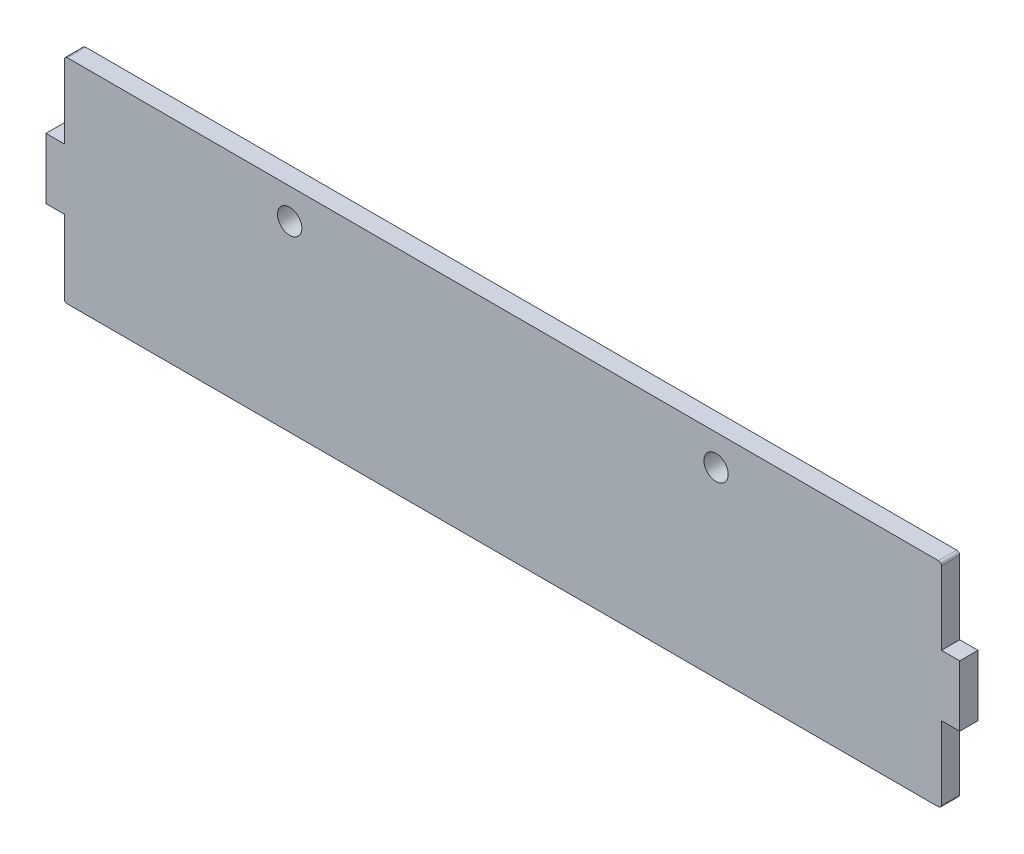
from build123d import *

# Parameters (mm, degrees)
SKETCH1_W   = 300
SKETCH1_H   = 70
FRONT_DEPTH = 6
SKETCH2_W   = 6
SKETCH2_H   = 25
SKETCH2_R   = 4
MOUNT_DEPTH = 309.116860947
FILLET_2_R  = 1


with BuildPart() as part:
    # Sketch1 → front (new body)
    with BuildSketch(Plane.XY):
        with Locations((150, 35)):
            Rectangle(SKETCH1_W, SKETCH1_H)
    extrude(amount=-FRONT_DEPTH)

    # Sketch2 → mount (cut, through all)
    with BuildSketch(Plane.XY):
        with Locations((297, 12.5)):
            Rectangle(SKETCH2_W, SKETCH2_H)
        with Locations((3, 12.5)):
            Rectangle(SKETCH2_W, SKETCH2_H)
        with Locations((3, 57.5)):
            Rectangle(SKETCH2_W, SKETCH2_H)
        with Locations((297, 57.5)):
            Rectangle(SKETCH2_W, SKETCH2_H)
        with Locations((80, 60)):
            Circle(SKETCH2_R)
        with Locations((220, 60)):
            Circle(SKETCH2_R)
    extrude(amount=-MOUNT_DEPTH, mode=Mode.SUBTRACT)

    # fillet 2
    fillet_2_edges = [part.edges().sort_by_distance(p)[0] for p in [
        (294, 0, -3),
        (294, 70, -3),
        (6, 0, -3),
        (6, 70, -3),
    ]]
    fillet(fillet_2_edges, radius=FILLET_2_R)


solid = part.part
